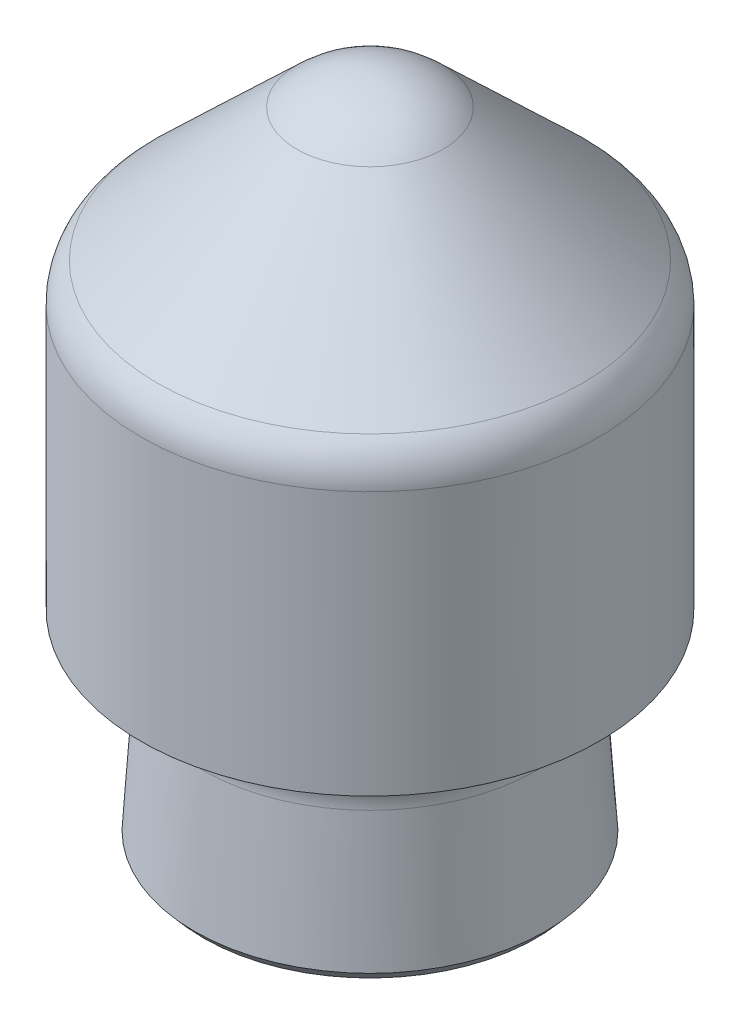
from build123d import *

# Parameters (mm, degrees)
FILLET1_R                  = 1.27
FILLET2_R                  = 1.27
CHAMFER1_SIZE              = 0.254
CHAMFER1_SIZE2             = 0.238876501
SKETCH4_R                  = 3.5
CUT_EXTRUDE1_DEPTH         = 2.5
M7X0_75_TAPPED_HOLE1_D     = 6
M7X0_75_TAPPED_HOLE1_DEPTH = 10.954004
M7X0_75_TAPPED_HOLE1_TIP   = 1.802581857


with BuildPart() as part:
    # Sketch1 → Revolve1 (revolve)
    with BuildSketch(Plane.XY):
        with BuildLine():
            Line((0, 25.4), (-4.2164, 25.4))
            Line((-4.2164, 25.4), (-3.899, 30.2387))
            Line((-3.899, 30.2387), (-5.4864, 30.2387))
            Line((-5.4864, 30.2387), (-5.4864, 37.0967))
            Line((-5.4864, 37.0967), (-1.750942839, 40.651254123))
            ThreePointArc((-1.750942839, 40.651254123), (-0.942831514, 41.169731055), (0, 41.3512))
            Line((0, 41.3512), (0, 25.4))
        make_face()
    revolve(axis=Axis((0, 25.4, 0), (0, 1, 0)))

    # Fillet1
    fillet1_edges = [part.edges().sort_by_distance(p)[0] for p in [
        (5.4864, 37.0967, 0),
    ]]
    fillet(fillet1_edges, radius=FILLET1_R)

    # Fillet2
    fillet2_edges = [part.edges().sort_by_distance(p)[0] for p in [
        (3.899, 30.2387, 0),
    ]]
    fillet(fillet2_edges, radius=FILLET2_R)

    # Chamfer1
    chamfer1_edges = [part.edges().sort_by_distance(p)[0] for p in [
        (4.2164, 25.4, 0),
    ]]
    chamfer1_side = [part.faces().sort_by_distance(p)[0] for p in [
        (4.102079995, 27.142785783, 0),
    ]]
    chamfer(chamfer1_edges, length=CHAMFER1_SIZE, length2=CHAMFER1_SIZE2, reference=chamfer1_side[0])

    # Sketch4 → Cut-Extrude1 (cut)
    with BuildSketch(Plane.XZ.offset(-25.4)):
        Circle(SKETCH4_R)
    extrude(amount=-CUT_EXTRUDE1_DEPTH, mode=Mode.SUBTRACT)

    # M7x0.75 Tapped Hole1
    with Locations(Plane(origin=(0, 25.4, 0), x_dir=(-1, 0, 0), z_dir=(0, -1, 0))):
        with Locations((0, 0), (96.139395676, -180.684699687)):
            Hole(M7X0_75_TAPPED_HOLE1_D / 2, depth=M7X0_75_TAPPED_HOLE1_DEPTH)
            with Locations((0, 0, -(M7X0_75_TAPPED_HOLE1_DEPTH + M7X0_75_TAPPED_HOLE1_TIP / 2))):  # 118° drill point
                Cone(0, M7X0_75_TAPPED_HOLE1_D / 2, M7X0_75_TAPPED_HOLE1_TIP, mode=Mode.SUBTRACT)


solid = part.part
